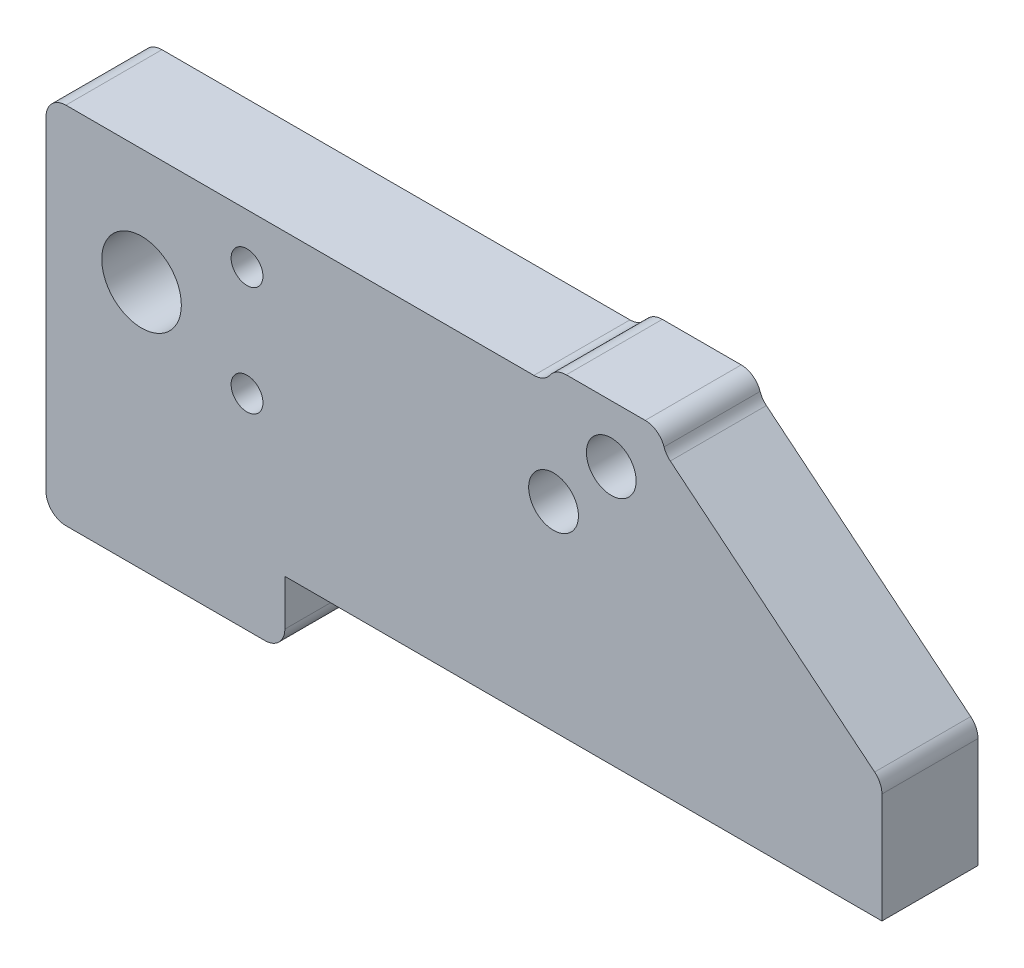
from build123d import *

# Parameters (mm, degrees)
BOSS_EXTRUDE1_DEPTH             = 4.826
M3X0_5_TAPPED_HOLE1_D           = 2.5
TAP_DRILL_FOR_M3X0_5_TAP1_D     = 2.5
TAP_DRILL_FOR_M3X0_5_TAP1_DEPTH = 5
TAP_DRILL_FOR_M3X0_5_TAP1_TIP   = 0.751075774
M3X0_5_TAPPED_HOLE2_D           = 2.5
SKETCH1_3_R                     = 2
BOSS_EXTRUDE2_DEPTH             = 4.826
FILLET1_R                       = 1
M1_TAPPED_HOLES_D               = 1.6
FILLET2_R                       = 1


with BuildPart() as part:
    # Sketch1 → Boss-Extrude1 (new body)
    with BuildSketch(Plane.XY):
        Polygon((-11, 0), (0, 0), (11, 0), (11, 6), (0, 15), (0, 15.837292271), (-5.5, 15.837292271), (-5.5, 15), (-11, 15), align=None)
    extrude(amount=BOSS_EXTRUDE1_DEPTH)

    # M3x0.5 Tapped Hole1 (through all)
    with Locations(Plane.XY.offset(4.826)):
        with Locations((-5.5, 10)):
            Hole(M3X0_5_TAPPED_HOLE1_D / 2)

    # Tap Drill for M3x0.5 Tap1
    with Locations(Plane(origin=(-4, 0, 2.413), x_dir=(0, 0, -1), z_dir=(0, -1, 0))):
        with Locations((0, 0), (0, 12)):
            Hole(TAP_DRILL_FOR_M3X0_5_TAP1_D / 2, depth=TAP_DRILL_FOR_M3X0_5_TAP1_DEPTH)
            with Locations((0, 0, -(TAP_DRILL_FOR_M3X0_5_TAP1_DEPTH + TAP_DRILL_FOR_M3X0_5_TAP1_TIP / 2))):  # 118° drill point
                Cone(0, TAP_DRILL_FOR_M3X0_5_TAP1_D / 2, TAP_DRILL_FOR_M3X0_5_TAP1_TIP, mode=Mode.SUBTRACT)

    # M3x0.5 Tapped Hole2 (through all)
    with Locations(Plane(origin=(-2.6, 12.97, 0), x_dir=(-1, 0, 0), z_dir=(0, 0, -1))):
        with Locations((0, 0)):
            Hole(M3X0_5_TAPPED_HOLE2_D / 2)

    # Sketch1<3> → Boss-Extrude2 (add)
    with BuildSketch(Plane.XY):
        Polygon((-19, 0), (-11, 0), (-11, 15), (-19, 15), (-31, 15), (-31, -3.3), (-19, -3.3), align=None)
        with Locations((-26.2, 9.2)):
            Circle(SKETCH1_3_R, mode=Mode.SUBTRACT)
    extrude(amount=BOSS_EXTRUDE2_DEPTH)

    # Fillet1
    # the kernel refuses this fillet: 1 mm, written as the material it adds along each edge
    with BuildSketch(Plane(origin=(-5.5, 15, 0), x_dir=(-1, 0, 0), z_dir=(0, 0, 1))) as fillet1_piece_1:
        with BuildLine():
            CenterArc((0.98667431, -1), FILLET1_R, 90, 80.635902393)
            Line((0, -0.837292271), (0, 0))
            Line((0, 0), (0.98667431, 0))
        make_face()
    extrude(amount=4.826)
    with BuildSketch(Plane(origin=(0, 15, 0), x_dir=(0, 1, 0), z_dir=(0, 0, 1))) as fillet1_piece_2:
        with BuildLine():
            CenterArc((FILLET1_R * 0.473879127596, -FILLET1_R), FILLET1_R, 90, 50.710593137)
            Line((-FILLET1_R * 0.300078171608, -FILLET1_R * 0.366762209743), (0, 0))
            Line((0, 0), (FILLET1_R * 0.473879127596, 0))
        make_face()
    extrude(amount=4.826)
    # the kernel refuses this fillet: 1 mm, written as the material it takes off along each edge
    with BuildSketch(Plane(origin=(-31, 15, -2.5), x_dir=(1, 0, 0), z_dir=(0, 0, 1)), Plane(origin=(-19, -3.3, -2.5), x_dir=(-1, 0, 0), z_dir=(0, 0, 1)), Plane(origin=(-31, -3.3, -2.5), x_dir=(0, 1, 0), z_dir=(0, 0, 1))) as fillet1_2_piece_1:
        with BuildLine():
            CenterArc((FILLET1_R, -FILLET1_R), FILLET1_R, 90, 90)
            Line((0, -FILLET1_R), (0, 0))
            Line((0, 0), (FILLET1_R, 0))
        make_face()
    extrude(amount=9.826, mode=Mode.SUBTRACT)
    with BuildSketch(Plane(origin=(11, 6, -1.184697819), x_dir=(0, -1, 0), z_dir=(0, 0, 1))) as fillet1_2_piece_2:
        with BuildLine():
            CenterArc((FILLET1_R * 0.473879127596, -FILLET1_R), FILLET1_R, 90, 50.710593137)
            Line((-FILLET1_R * 0.300078171608, -FILLET1_R * 0.366762209743), (0, 0))
            Line((0, 0), (FILLET1_R * 0.473879127596, 0))
        make_face()
    extrude(amount=7.195395638, mode=Mode.SUBTRACT)

    # M1 Tapped Holes (through all)
    with Locations(Plane.XY.offset(4.826)):
        with Locations((-20.9, 12.5), (-20.9, 7)):
            Hole(M1_TAPPED_HOLES_D / 2)

    # Fillet2
    fillet2_edges = [part.edges().sort_by_distance(p)[0] for p in [
        (0, 15.837292271, 2.413),
        (-5.5, 15.837292271, 2.413),
    ]]
    fillet(fillet2_edges, radius=FILLET2_R)


solid = part.part
